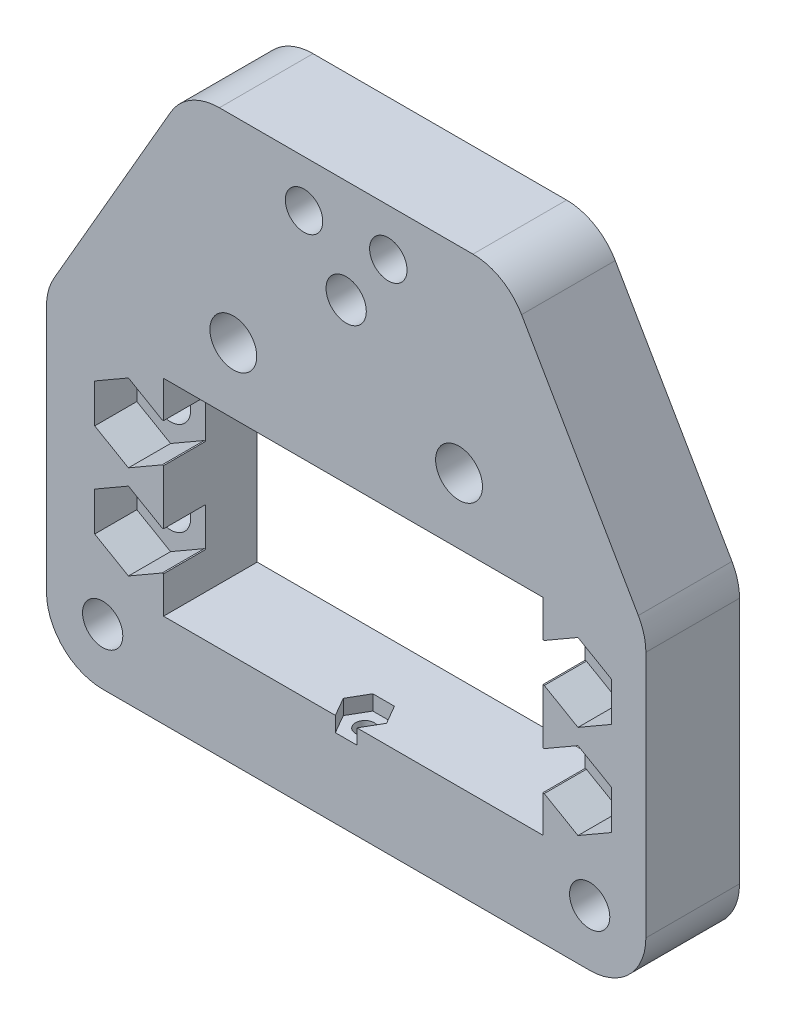
from build123d import *

# Parameters (mm, degrees)
EXTRUDE_1_DEPTH         = 10
FILLET_1_R              = 6
SKETCH_2_W              = 40.5
SKETCH_2_H              = 22
CUT_EXTRUDE_1_DEPTH     = 89.294960219
HOLE_WIZARD_4_0_1_D     = 4
HOLE_WIZARD_5_0_1_D     = 5
HOLE_WIZARD_M41_D       = 4.3
CUT_EXTRUDE_4_DEPTH     = 4.5
HOLE_WIZARD_M42_D       = 4.3
CUT_EXTRUDE_7_DEPTH     = 3.2
SKETCH_19_W             = 4.5
SKETCH_19_H             = 4.156921938
CUT_EXTRUDE_13_DEPTH    = 0.15
SKETCH_21_W             = 4.5
SKETCH_21_H             = 4.156921938
CUT_EXTRUDE_14_DEPTH    = 0.15
SKETCH_22_W             = 4.5
SKETCH_22_H             = 4.156921938
CUT_EXTRUDE_15_DEPTH    = 0.15
SKETCH_23_W             = 4.5
SKETCH_23_H             = 4.156921938
CUT_EXTRUDE_16_DEPTH    = 0.15
CUT_EXTRUDE_17_DEPTH    = 1.6
HOLE_WIZARD_M2_21_D     = 2
HOLE_WIZARD_M2_21_DEPTH = 10
HOLE_WIZARD_M2_21_TIP   = 0.600860619


with BuildPart() as part:
    # Эскиз1 → Бобышка-Вытянуть1 (new body)
    with BuildSketch(Plane.XY):
        Polygon((0, 0), (64, 0), (64, 34.019237886), (49, 60), (15, 60), (0, 34.02), align=None)
    extrude(amount=EXTRUDE_1_DEPTH)

    # Скругление1
    fillet_1_edges = [part.edges().sort_by_distance(p)[0] for p in [
        (49, 60, 5),
        (15, 60, 5),
        (0, 34.02, 5),
        (0, 0, 5),
        (64, 34.019237886, 5),
        (64, 0, 5),
    ]]
    fillet(fillet_1_edges, radius=FILLET_1_R)

    # Эскиз2 → Вырез-Вытянуть1 (cut, through all)
    with BuildSketch(Plane.XY.offset(10)):
        with Locations((32.75, 21)):
            Rectangle(SKETCH_2_W, SKETCH_2_H)
    extrude(amount=-CUT_EXTRUDE_1_DEPTH, mode=Mode.SUBTRACT)

    # Отверстия под штифты Ø4.0 мм1 (through all)
    with Locations(Plane.XY.offset(10)):
        with Locations((27.499949191, 55), (36.5, 55)):
            Hole(HOLE_WIZARD_4_0_1_D / 2)

    # Отверстия под штифты Ø5.0 мм1 (through all)
    with Locations(Plane.XY.offset(10)):
        with Locations((19.949949191, 39), (44.05, 39)):
            Hole(HOLE_WIZARD_5_0_1_D / 2)

    # Сверло под метчик  спиральное M41 (through all)
    with Locations(Plane.XY.offset(10)):
        with Locations((56.75, 26), (56.75, 16), (8.75, 26), (8.75, 16)):
            Hole(HOLE_WIZARD_M41_D / 2)

    # Эскиз9 → Вырез-Вытянуть4 (cut)
    with BuildSketch(Plane(origin=(0, 0, 10), x_dir=(-1, 0, 0), z_dir=(0, 0, -1))):
        Polygon((-56.75, 30.156921938), (-60.35, 28.078460969), (-60.35, 23.921539031), (-56.75, 21.843078062), (-53.15, 23.921539031), (-53.15, 28.078460969), align=None)
        Polygon((-56.75, 20.156921938), (-60.35, 18.078460969), (-60.35, 13.921539031), (-56.75, 11.843078062), (-53.15, 13.921539031), (-53.15, 18.078460969), align=None)
        Polygon((-8.75, 30.156921938), (-12.35, 28.078460969), (-12.35, 23.921539031), (-8.75, 21.843078062), (-5.15, 23.921539031), (-5.15, 28.078460969), align=None)
        Polygon((-8.75, 20.156921938), (-12.35, 18.078460969), (-12.35, 13.921539031), (-8.75, 11.843078062), (-5.15, 13.921539031), (-5.15, 18.078460969), align=None)
    extrude(amount=CUT_EXTRUDE_4_DEPTH, mode=Mode.SUBTRACT)

    # Сверло под метчик  спиральное M42 (through all)
    with Locations(Plane.XY.offset(10)):
        with Locations((32, 49), (6, 6), (58, 6)):
            Hole(HOLE_WIZARD_M42_D / 2)

    # Эскиз18 → Вырез-Вытянуть7 (cut)
    with BuildSketch(Plane(origin=(0, 0, 0), x_dir=(-1, 0, 0), z_dir=(0, 0, -1))):
        Polygon((-32, 53.156921938), (-35.6, 51.078460969), (-35.6, 46.921539031), (-32, 44.843078062), (-28.4, 46.921539031), (-28.4, 51.078460969), align=None)
        Polygon((-58, 10.156921938), (-61.6, 8.078460969), (-61.6, 3.921539031), (-58, 1.843078062), (-54.4, 3.921539031), (-54.4, 8.078460969), align=None)
        Polygon((-6, 10.156921938), (-9.6, 8.078460969), (-9.6, 3.921539031), (-6, 1.843078062), (-2.4, 3.921539031), (-2.4, 8.078460969), align=None)
    extrude(amount=-CUT_EXTRUDE_7_DEPTH, mode=Mode.SUBTRACT)

    # Эскиз19 → Вырез-Вытянуть13 (cut)
    with BuildSketch(Plane.ZY.offset(-53)):
        with Locations((7.75, 26)):
            Rectangle(SKETCH_19_W, SKETCH_19_H)
    extrude(amount=-CUT_EXTRUDE_13_DEPTH, mode=Mode.SUBTRACT)

    # Эскиз21 → Вырез-Вытянуть14 (cut)
    with BuildSketch(Plane(origin=(12.5, 0, 0), x_dir=(0, 0, -1), z_dir=(1, 0, 0))):
        with Locations((-7.75, 26)):
            Rectangle(SKETCH_21_W, SKETCH_21_H)
    extrude(amount=-CUT_EXTRUDE_14_DEPTH, mode=Mode.SUBTRACT)

    # Эскиз22 → Вырез-Вытянуть15 (cut)
    with BuildSketch(Plane.ZY.offset(-53)):
        with Locations((7.75, 16)):
            Rectangle(SKETCH_22_W, SKETCH_22_H)
    extrude(amount=-CUT_EXTRUDE_15_DEPTH, mode=Mode.SUBTRACT)

    # Эскиз23 → Вырез-Вытянуть16 (cut)
    with BuildSketch(Plane(origin=(12.5, 0, 0), x_dir=(0, 0, -1), z_dir=(1, 0, 0))):
        with Locations((-7.75, 16)):
            Rectangle(SKETCH_23_W, SKETCH_23_H)
    extrude(amount=-CUT_EXTRUDE_16_DEPTH, mode=Mode.SUBTRACT)

    # Эскиз12 → Вырез-Вытянуть17 (cut)
    with BuildSketch(Plane(origin=(0, 10, 0), x_dir=(1, 0, 0), z_dir=(0, 1, 0))):
        Polygon((34.309375673, -8), (33.154675134, -6), (30.845274057, -6), (29.690573519, -8), (30.845274057, -10), (33.154675134, -10), align=None)
    extrude(amount=-CUT_EXTRUDE_17_DEPTH, mode=Mode.SUBTRACT)

    # Сверло под метчик  спиральное M2.21
    with Locations(Plane(origin=(0, 0, 0), x_dir=(-1, 0, 0), z_dir=(0, -1, 0))):
        with Locations((-32, -8)):
            Hole(HOLE_WIZARD_M2_21_D / 2, depth=HOLE_WIZARD_M2_21_DEPTH)
            with Locations((0, 0, -(HOLE_WIZARD_M2_21_DEPTH + HOLE_WIZARD_M2_21_TIP / 2))):  # 118° drill point
                Cone(0, HOLE_WIZARD_M2_21_D / 2, HOLE_WIZARD_M2_21_TIP, mode=Mode.SUBTRACT)


solid = part.part
